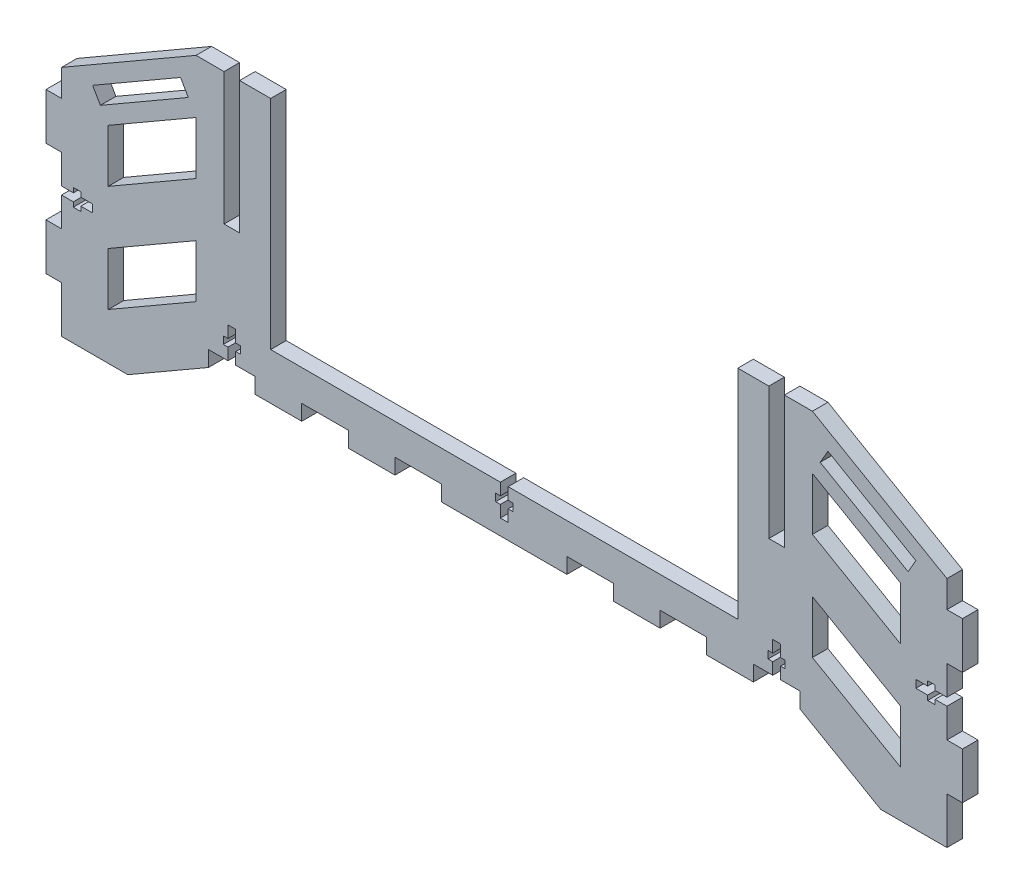
from build123d import *

# Parameters (mm, degrees)
ESTRUSIONE_ESTRUSIONE1_DEPTH = 5
TAGLIO_ESTRUSIONE2_DEPTH     = 179.27296486
SCHIZZO5_W                   = 15
SCHIZZO5_H                   = 5
SCHIZZO5_W_2                 = 5
SCHIZZO5_H_2                 = 42.5
SCHIZZO5_W_3                 = 150.358983848
SCHIZZO5_H_3                 = 70
TAGLIO_ESTRUSIONE3_DEPTH     = 179.27296486
TAGLIO_ESTRUSIONE4_DEPTH     = 179.27296486


with BuildPart() as part:
    # Schizzo1 → Estrusione-Estrusione1 (new body)
    with BuildSketch(Plane.XY):
        Polygon((-142.5, 75), (-142.5, 66.339745962), (-147.5, 66.339745962), (-147.5, 51.339745962), (-142.5, 51.339745962), (-142.5, 30), (-147.5, 30), (-147.5, 15), (-142.5, 15), (-142.5, 0), (142.5, 0), (142.5, 15), (147.5, 15), (147.5, 30), (142.5, 30), (142.5, 51.339745962), (147.5, 51.339745962), (147.5, 66.339745962), (142.5, 66.339745962), (142.5, 75), (99.198729811, 100), (-99.198729811, 100), align=None)
    extrude(amount=ESTRUSIONE_ESTRUSIONE1_DEPTH)

    # Schizzo2 → Taglio-Estrusione2 (cut, through all)
    with BuildSketch(Plane.XY):
        Polygon((-99.198729811, 82.679491924), (-127.5, 66.339745962), (-127.5, 49.330127019), (-99.198729811, 65.669872981), align=None)
        Polygon((99.198729811, 31.339745962), (99.198729811, 48.349364905), (127.5, 32.009618943), (127.5, 15), align=None)
        Polygon((-95.179491924, 15), (-121.160254038, 0), (121.160254038, 0), (95.179491924, 15), align=None)
        Polygon((-99.198729811, 31.339745962), (-127.5, 15), (-127.5, 32.009618943), (-99.198729811, 48.349364905), align=None)
        Polygon((99.198729811, 65.669872981), (99.198729811, 82.679491924), (127.5, 66.339745962), (127.5, 49.330127019), align=None)
        Polygon((-132.5, 75), (-104.198729811, 91.339745962), (-101.698729811, 87.009618943), (-130, 70.669872981), align=None)
        Polygon((132.5, 75), (130, 70.669872981), (101.698729811, 87.009618943), (104.198729811, 91.339745962), align=None)
    extrude(amount=TAGLIO_ESTRUSIONE2_DEPTH, mode=Mode.SUBTRACT)

    # Schizzo5 → Taglio-Estrusione3 (cut, through all)
    with BuildSketch(Plane.XY):
        with Locations((-87.679491924, 17.5)):
            Rectangle(SCHIZZO5_W, SCHIZZO5_H)
        with Locations((-57.679491924, 17.5)):
            Rectangle(SCHIZZO5_W, SCHIZZO5_H)
        with Locations((-27.679491924, 17.5)):
            Rectangle(SCHIZZO5_W, SCHIZZO5_H)
        with Locations((27.679491924, 17.5)):
            Rectangle(SCHIZZO5_W, SCHIZZO5_H)
        with Locations((57.679491924, 17.5)):
            Rectangle(SCHIZZO5_W, SCHIZZO5_H)
        with Locations((87.679491924, 17.5)):
            Rectangle(SCHIZZO5_W, SCHIZZO5_H)
        with Locations((87.679491924, 78.75)):
            Rectangle(SCHIZZO5_W_2, SCHIZZO5_H_2)
        with Locations((-87.679491924, 78.75)):
            Rectangle(SCHIZZO5_W_2, SCHIZZO5_H_2)
        with Locations((0, 65)):
            Rectangle(SCHIZZO5_W_3, SCHIZZO5_H_3)
    extrude(amount=TAGLIO_ESTRUSIONE3_DEPTH, mode=Mode.SUBTRACT)

    # Schizzo6 → Taglio-Estrusione4 (cut, through all)
    with BuildSketch(Plane.XY):
        Polygon((-142.5, 41.919872981), (-138.7, 41.919872981), (-138.7, 43.419872981), (-136.3, 43.419872981), (-136.3, 41.919872981), (-132.5, 41.919872981), (-132.5, 39.419872981), (-136.3, 39.419872981), (-136.3, 37.919872981), (-138.7, 37.919872981), (-138.7, 39.419872981), (-142.5, 39.419872981), align=None)
        Polygon((136.3, 43.419872981), (136.3, 41.919872981), (132.5, 41.919872981), (132.5, 39.419872981), (136.3, 39.419872981), (136.3, 37.919872981), (138.7, 37.919872981), (138.7, 39.419872981), (142.5, 39.419872981), (142.5, 41.919872981), (138.7, 41.919872981), (138.7, 43.419872981), align=None)
        Polygon((-88.929491924, 20), (-88.929491924, 23.8), (-90.429491924, 23.8), (-90.429491924, 26.2), (-88.929491924, 26.2), (-88.929491924, 30), (-86.429491924, 30), (-86.429491924, 26.2), (-84.929491924, 26.2), (-84.929491924, 23.8), (-86.429491924, 23.8), (-86.429491924, 20), align=None)
        Polygon((86.429491924, 20), (88.929491924, 20), (88.929491924, 23.8), (90.429491924, 23.8), (90.429491924, 26.2), (88.929491924, 26.2), (88.929491924, 30), (86.429491924, 30), (86.429491924, 26.2), (84.929491924, 26.2), (84.929491924, 23.8), (86.429491924, 23.8), align=None)
        Polygon((-1.25, 20), (-1.25, 23.8), (-2.75, 23.8), (-2.75, 26.2), (-1.25, 26.2), (-1.25, 30), (1.25, 30), (1.25, 26.2), (2.75, 26.2), (2.75, 23.8), (1.25, 23.8), (1.25, 20), align=None)
    extrude(amount=TAGLIO_ESTRUSIONE4_DEPTH, mode=Mode.SUBTRACT)


solid = part.part
